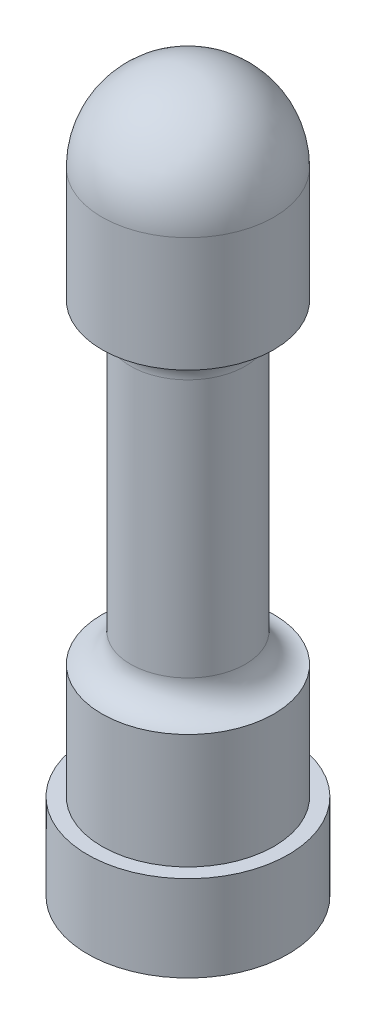
from build123d import *

# Parameters (mm, degrees)
FILLET1_R = 3
FILLET2_R = 1


with BuildPart() as part:
    # Sketch1 → Revolve1 (revolve)
    with BuildSketch(Plane.XY, mode=Mode.PRIVATE) as revolve1_sk:
        Polygon((3, 18), (2, 18), (2, 7), (3, 7), (3, 3), (3.5, 3), (3.5, 0), (0, 0), (0, 25), (3, 25), align=None)
    revolve(revolve1_sk.sketch.rotate(Axis((0, 0, 0), (0, 1, 0)), 90), axis=Axis((0, 0, 0), (0, 1, 0)))

    # Fillet1
    fillet1_edges = [part.edges().sort_by_distance(p)[0] for p in [
        (0, 25, 3),
    ]]
    fillet(fillet1_edges, radius=FILLET1_R)

    # Fillet2
    fillet2_edges = [part.edges().sort_by_distance(p)[0] for p in [
        (0, 7, 2),
        (0, 18, 2),
    ]]
    fillet(fillet2_edges, radius=FILLET2_R - 0.0001)  # a hair under: the kernel refuses the full size

    # Sketch2 → Cut-Revolve1 (revolve, cut)
    with BuildSketch(Plane.XY, mode=Mode.PRIVATE) as cut_revolve1_sk:
        with BuildLine():
            Line((0, 0), (0, 1.5))
            ThreePointArc((0, 1.5), (1.060660172, 1.060660172), (1.5, 0))
            Line((1.5, 0), (0, 0))
        make_face()
    revolve(cut_revolve1_sk.sketch.rotate(Axis((0, 0, 0), (0, 1, 0)), 90), axis=Axis((0, 0, 0), (0, 1, 0)), mode=Mode.SUBTRACT)


solid = part.part
